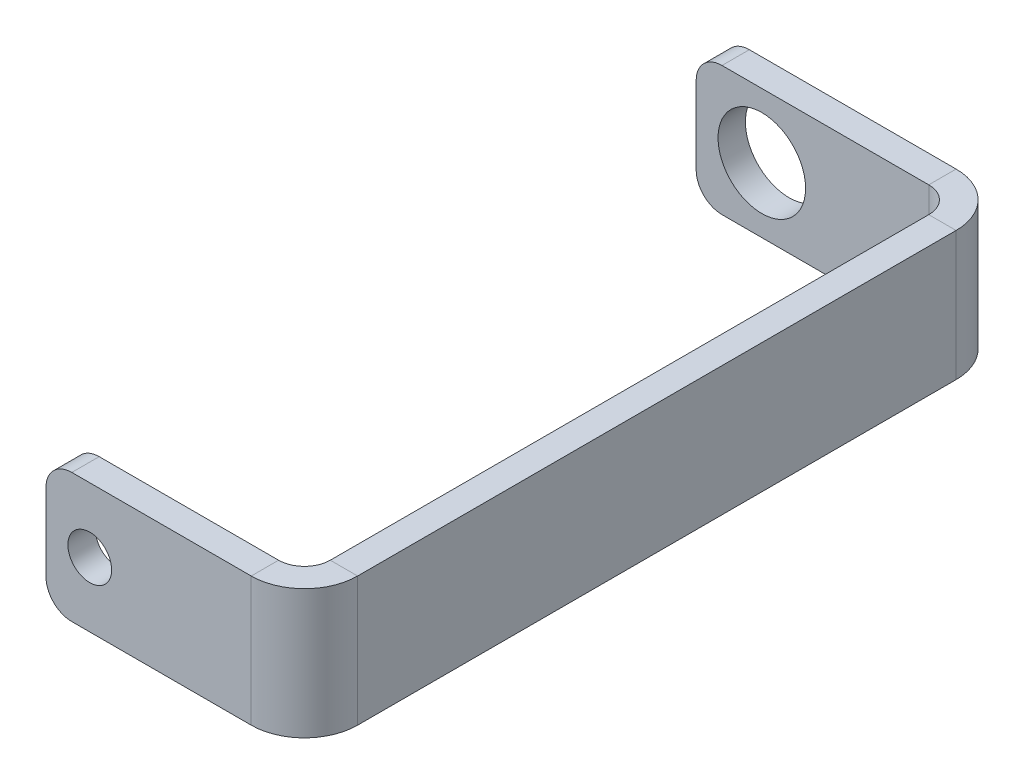
from build123d import *

# Parameters (mm, degrees)
SKETCH1_W                    = 30
SKETCH1_H                    = 15
BASE_FLANGE1_DEPTH           = 3.175
EDGE_FLANGE1_STRIP_W         = 18.7
EDGE_FLANGE1_STRIP_H         = 3.175
EDGE_FLANGE1_STRIP_CUT_DEPTH = 15
EDGE_FLANGE1_DEPTH           = 15
EDGE_FLANGE2_STRIP_W         = 18.7
EDGE_FLANGE2_STRIP_H         = 3.175
EDGE_FLANGE2_STRIP_CUT_DEPTH = 15
EDGE_FLANGE2_DEPTH           = 15
SKETCH14_R                   = 5.08
CUT_EXTRUDE1_DEPTH           = 82.072299394
SKETCH15_R                   = 2.54
CUT_EXTRUDE2_DEPTH           = 10
FILLET1_R                    = 3


# Sheet-metal steps are written as plain solids
with BuildPart() as part:
    # Sketch1 → Base-Flange1 (new body)
    with BuildSketch(Plane.XY):
        Rectangle(SKETCH1_W, SKETCH1_H)
    extrude(amount=-BASE_FLANGE1_DEPTH)

    # Edge-Flange1 strip (across the edge) → Edge-Flange1 strip cut (cut)
    with BuildSketch(Plane(origin=(15, -7.5, 0), x_dir=(-1, 0, 0), z_dir=(0, 1, 0))):
        with Locations((-6.35, -1.5875)):
            Rectangle(EDGE_FLANGE1_STRIP_W, EDGE_FLANGE1_STRIP_H)
    extrude(amount=EDGE_FLANGE1_STRIP_CUT_DEPTH, mode=Mode.SUBTRACT)

    # Edge-Flange1 section (across the edge) → Edge-Flange1 (add)
    with BuildSketch(Plane(origin=(15, -7.5, 0), x_dir=(-1, 0, 0), z_dir=(0, 1, 0))):
        with BuildLine():
            Line((-3.175, 3), (-3.175, 75.477))
            Line((-3.175, 75.477), (0, 75.477))
            Line((0, 75.477), (0, 3))
            ThreePointArc((0, 3), (0.878679656, 0.878679656), (3, 0))
            Line((3, 0), (3, -3.175))
            ThreePointArc((3, -3.175), (-1.366384374, -1.366384374), (-3.175, 3))
        make_face()
    extrude(amount=EDGE_FLANGE1_DEPTH)

    # Edge-Flange2 strip (across the edge) → Edge-Flange2 strip cut (cut)
    with BuildSketch(Plane(origin=(15, -7.5, 75.477), x_dir=(0, 0, -1), z_dir=(0, 1, 0))):
        with Locations((-6.35, -1.5875)):
            Rectangle(EDGE_FLANGE2_STRIP_W, EDGE_FLANGE2_STRIP_H)
    extrude(amount=EDGE_FLANGE2_STRIP_CUT_DEPTH, mode=Mode.SUBTRACT)

    # Edge-Flange2 section (across the edge) → Edge-Flange2 (add)
    with BuildSketch(Plane(origin=(15, -7.5, 75.477), x_dir=(0, 0, -1), z_dir=(0, 1, 0))):
        with BuildLine():
            Line((-3.175, 3), (-3.175, 26.825))
            Line((-3.175, 26.825), (0, 26.825))
            Line((0, 26.825), (0, 3))
            ThreePointArc((0, 3), (0.878679656, 0.878679656), (3, 0))
            Line((3, 0), (3, -3.175))
            ThreePointArc((3, -3.175), (-1.366384374, -1.366384374), (-3.175, 3))
        make_face()
    extrude(amount=EDGE_FLANGE2_DEPTH)

    # Sketch14 → Cut-Extrude1 (cut, through all)
    with BuildSketch(Plane.XY):
        with Locations((-7.38, 0)):
            Circle(SKETCH14_R)
    extrude(amount=-CUT_EXTRUDE1_DEPTH, mode=Mode.SUBTRACT)

    # Sketch15 → Cut-Extrude2 (cut)
    with BuildSketch(Plane.XY.offset(78.652)):
        with Locations((-6.745, 0)):
            Circle(SKETCH15_R)
    extrude(amount=-CUT_EXTRUDE2_DEPTH, mode=Mode.SUBTRACT)

    # Fillet1
    fillet1_edges = [part.edges().sort_by_distance(p)[0] for p in [
        (-11.825, -7.5, 77.0645),
        (-11.825, 7.5, 77.0645),
        (-15, -7.5, -1.5875),
        (-15, 7.5, -1.5875),
    ]]
    fillet(fillet1_edges, radius=FILLET1_R)


solid = part.part
